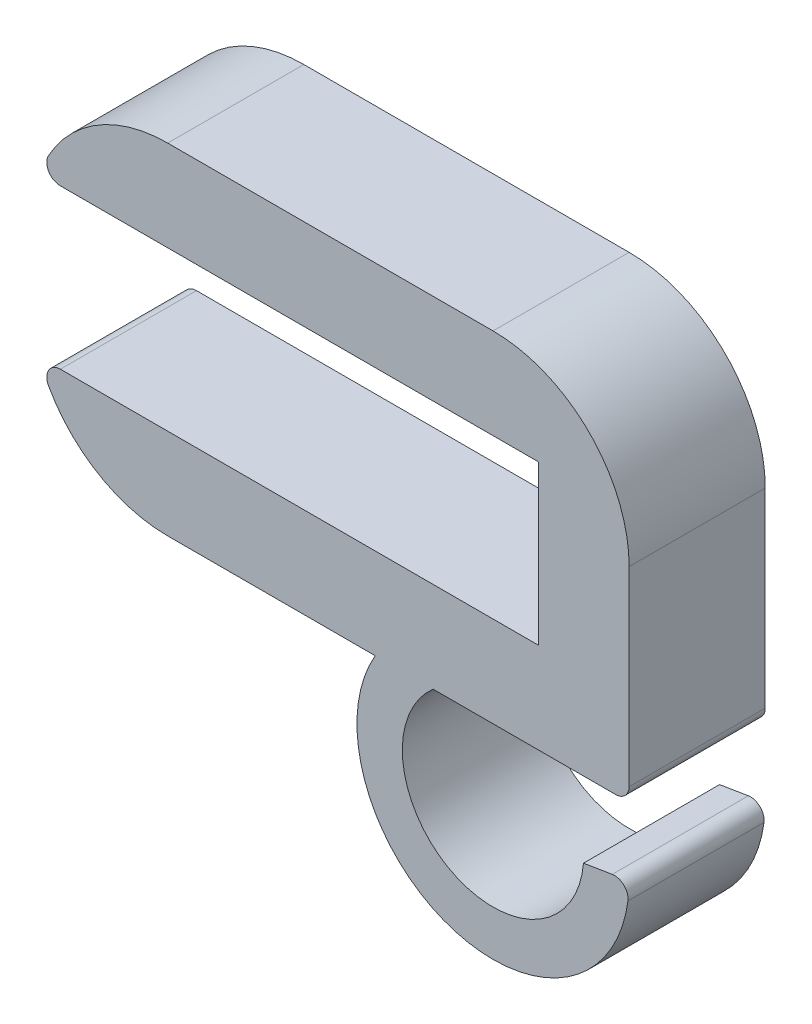
from build123d import *

# Parameters (mm, degrees)
SZKIC1_W                    = 13
SZKIC1_H                    = 7.5
DODANIE_WYCI_GNI_CIE1_DEPTH = 3
SZKIC2_W                    = 11
SZKIC2_H                    = 3.5
WYTNIJ_WYCI_GNI_CIE1_DEPTH  = 3
ZAOKR_GLENIE1_R             = 3
SZKIC3_R                    = 3
SZKIC3_R_2                  = 2
DODANIE_WYCI_GNI_CIE2_DEPTH = 3
WYTNIJ_WYCI_GNI_CIE2_DEPTH  = 3
ZAOKR_GLENIE2_R             = 0.3


with BuildPart() as part:
    # Szkic1 → Dodanie-wyciągnięcie1 (new body)
    with BuildSketch(Plane.XY):
        with Locations((6.5, 3.75)):
            Rectangle(SZKIC1_W, SZKIC1_H)
    extrude(amount=DODANIE_WYCI_GNI_CIE1_DEPTH)

    # Szkic2 → Wytnij-wyciągnięcie1 (cut)
    with BuildSketch(Plane.XY.offset(3)):
        with Locations((5.5, 3.75)):
            Rectangle(SZKIC2_W, SZKIC2_H)
    extrude(amount=-WYTNIJ_WYCI_GNI_CIE1_DEPTH, mode=Mode.SUBTRACT)

    # Zaokrąglenie1
    # the kernel refuses this fillet: 3 mm, written as the material it takes off along each edge
    with BuildSketch(Plane(origin=(13, 7.5, -7.5), x_dir=(0, -1, 0), z_dir=(0, 0, 1))) as zaokr_glenie1_piece_1:
        with BuildLine():
            CenterArc((ZAOKR_GLENIE1_R, -ZAOKR_GLENIE1_R), ZAOKR_GLENIE1_R, 90, 90)
            Line((0, -ZAOKR_GLENIE1_R), (-ZAOKR_GLENIE1_R * 0.02, -ZAOKR_GLENIE1_R))
            Line((-ZAOKR_GLENIE1_R * 0.02, -ZAOKR_GLENIE1_R), (-ZAOKR_GLENIE1_R * 0.02, ZAOKR_GLENIE1_R * 0.02))
            Line((-ZAOKR_GLENIE1_R * 0.02, ZAOKR_GLENIE1_R * 0.02), (ZAOKR_GLENIE1_R, ZAOKR_GLENIE1_R * 0.02))
            Line((ZAOKR_GLENIE1_R, ZAOKR_GLENIE1_R * 0.02), (ZAOKR_GLENIE1_R, 0))
        make_face()
    extrude(amount=18, mode=Mode.SUBTRACT)
    with BuildSketch(Plane(origin=(0, 0, -7.071067812), x_dir=(1, 0, 0), z_dir=(0, 0, 1))) as zaokr_glenie1_piece_2:
        with BuildLine():
            CenterArc((2.828427125, 3), ZAOKR_GLENIE1_R, 199.471220634, 70.528779366)
            Line((0, 2), (-0.056568542, 1.98))
            ThreePointArc((-0.056568542, 1.98), (-0.06, 1), (-0.06, 0))
            Line((-0.06, 0), (0, -0.06))
            Line((0, -0.06), (2.828427125, -0.06))
            Line((2.828427125, -0.06), (2.828427125, 0))
        make_face()
    extrude(amount=17.142135624, mode=Mode.SUBTRACT)
    with BuildSketch(Plane(origin=(0, 7.5, -7.071067812), x_dir=(1, 0, 0), z_dir=(0, 0, 1))) as zaokr_glenie1_piece_3:
        with BuildLine():
            CenterArc((2.828427125, -3), ZAOKR_GLENIE1_R, 90, 70.528779366)
            Line((0, -2), (-0.056568542, -1.98))
            ThreePointArc((-0.056568542, -1.98), (-0.06, -1), (-0.06, 0))
            Line((-0.06, 0), (0, 0.06))
            Line((0, 0.06), (2.828427125, 0.06))
            Line((2.828427125, 0.06), (2.828427125, 0))
        make_face()
    extrude(amount=17.142135624, mode=Mode.SUBTRACT)

    # Szkic3 → Dodanie-wyciągnięcie2 (add)
    with BuildSketch(Plane.XY.offset(3)):
        with Locations((10, -1.5)):
            Circle(SZKIC3_R)
        with Locations((10, -1.5)):
            Circle(SZKIC3_R_2, mode=Mode.SUBTRACT)
    extrude(amount=-DODANIE_WYCI_GNI_CIE2_DEPTH)

    # Szkic4 → Wytnij-wyciągnięcie2 (cut)
    with BuildSketch(Plane.XY.offset(3)):
        Polygon((10, 0), (13, 0), (13, -1.5), (10, -1.990922123), align=None)
    extrude(amount=-WYTNIJ_WYCI_GNI_CIE2_DEPTH, mode=Mode.SUBTRACT)

    # Zaokrąglenie2
    zaokr_glenie2_edges = [part.edges().sort_by_distance(p)[0] for p in [
        (0, 2, 1.5),
        (0, 5.5, 1.5),
        (13, -1.5, 1.5),
        (13, 0, 1.5),
    ]]
    fillet(zaokr_glenie2_edges, radius=ZAOKR_GLENIE2_R)


solid = part.part
